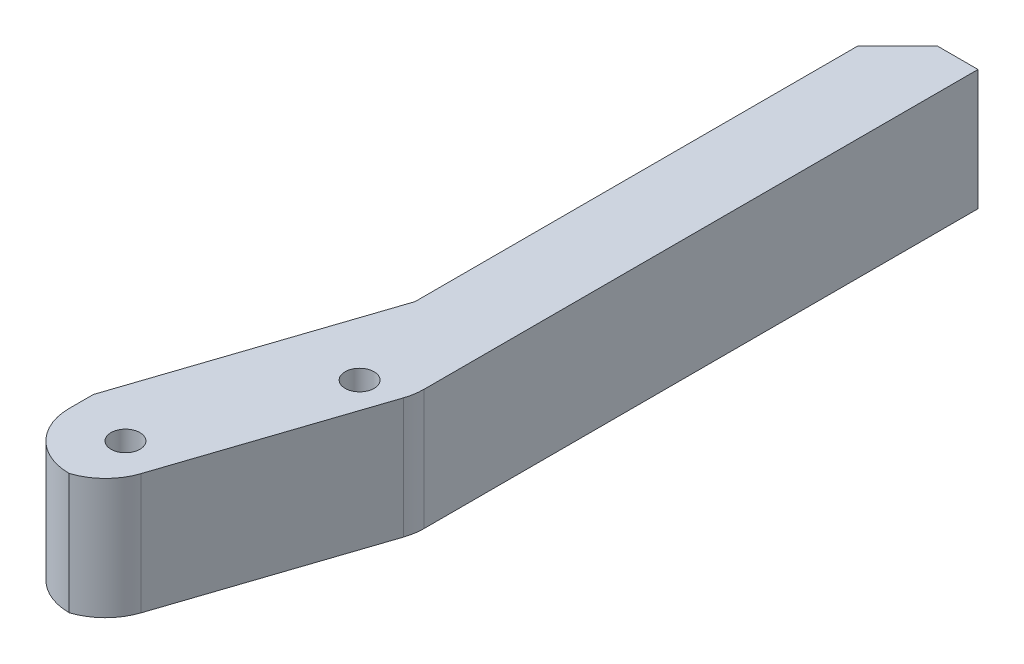
from build123d import *

# Parameters (mm, degrees)
BOSS_EXTRUDE1_DEPTH = 15
FILLET1_R           = 7
SKETCH2_R           = 1.8
CUT_EXTRUDE1_DEPTH  = 66.559736532
FILLET3_R           = 7
FILLET5_R           = 7
CHAMFER2_SIZE       = 5


with BuildPart() as part:
    # Sketch1 → Boss-Extrude1 (new body)
    with BuildSketch(Plane(origin=(0, 0, 0), x_dir=(1, 0, 0), z_dir=(0, 1, 0))):
        Polygon((10.928961749, 60.29143898), (10.928961749, 0.29143898), (0.928961749, -29.70856102), (0.928961749, -39.70856102), (10.928961749, -39.70856102), (20.928961749, -9.70856102), (20.928961749, 60.29143898), align=None)
    extrude(amount=BOSS_EXTRUDE1_DEPTH)

    # Fillet1
    fillet1_edges = [part.edges().sort_by_distance(p)[0] for p in [
        (0.928961749, 7.5, 39.70856102),
    ]]
    fillet(fillet1_edges, radius=FILLET1_R)

    # Sketch2 → Cut-Extrude1 (cut, through all)
    with BuildSketch(Plane(origin=(0, 15, 0), x_dir=(1, 0, 0), z_dir=(0, 1, 0))):
        with Locations(Location((15.928961749, -11.599196317, 0), (0, 0, 270))):
            Circle(SKETCH2_R)
        with Locations(Location((7.928961749, -32.70856102, 0), (0, 0, 270))):
            Circle(SKETCH2_R)
    extrude(amount=-CUT_EXTRUDE1_DEPTH, mode=Mode.SUBTRACT)

    # Fillet3
    # the kernel refuses this fillet: 7 mm, written as the material it takes off along each edge
    with BuildSketch(Plane(origin=(10.928961749, -11.713900217, 39.70856102), x_dir=(-1, 0, 0), z_dir=(0, 1, 0))) as fillet3_piece_1:
        with BuildLine():
            CenterArc((5.159078888, -6.658706958), FILLET3_R, 107.965233202, 53.599817975)
            Line((-1.481704199, -4.445112596), (-1.61451986, -4.400840709))
            Line((-1.61451986, -4.400840709), (-0.132815662, 0.044271887))
            Line((-0.132815662, 0.044271887), (0, 0.14))
            ThreePointArc((0, 0.14), (1.5, 0.14), (2.956818422, 0.133174139))
            Line((2.956818422, 0.133174139), (3, 0))
        make_face()
    extrude(amount=38.427800433, mode=Mode.SUBTRACT)

    # Fillet5
    fillet5_edges = [part.edges().sort_by_distance(p)[0] for p in [
        (20.928961749, 7.5, 9.70856102),
    ]]
    fillet(fillet5_edges, radius=FILLET5_R)

    # Chamfer2
    chamfer2_edges = [part.edges().sort_by_distance(p)[0] for p in [
        (10.928961749, 7.5, -60.29143898),
    ]]
    chamfer(chamfer2_edges, length=CHAMFER2_SIZE)


solid = part.part
